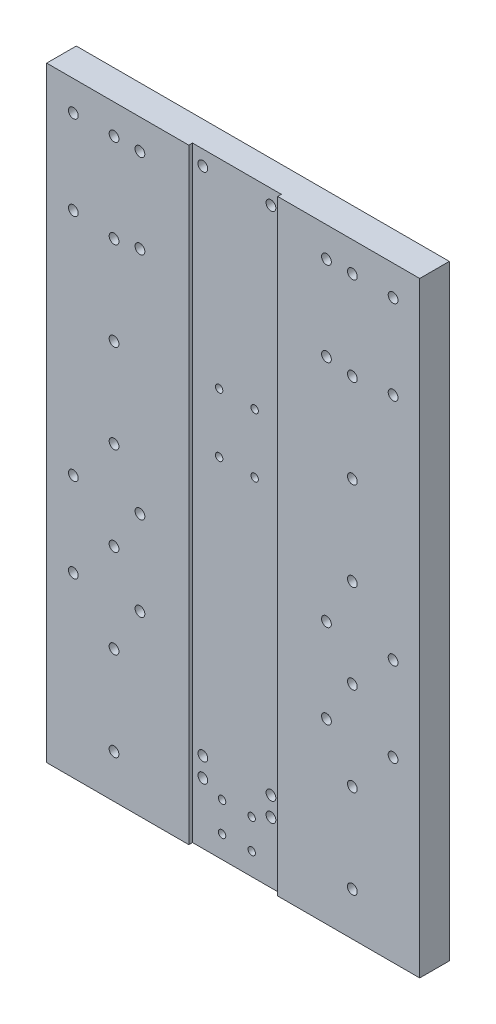
from build123d import *

# Parameters (mm, degrees)
SCHIZZO1_W                    = 252
SCHIZZO1_H                    = 500
ESTRUSIONE_ESTRUSIONE1_DEPTH  = 20
SCHIZZO3_W                    = 60
SCHIZZO3_H                    = 2.5
TAGLIO_ESTRUSIONE1_DEPTH      = 517.019379481
M6_CLEARANCE_HOLE2_AT_2_COUNT = 2
M6_CLEARANCE_HOLE2_AT_2_PITCH = 60
M6_CLEARANCE_HOLE2_AT_3_COUNT = 2
M6_CLEARANCE_HOLE2_AT_3_PITCH = 120
M6_CLEARANCE_HOLE2_AT_4_COUNT = 2
M6_CLEARANCE_HOLE2_AT_4_PITCH = 180
M6_CLEARANCE_HOLE2_AT_5_COUNT = 2
M6_CLEARANCE_HOLE2_AT_5_PITCH = 240
M6_CLEARANCE_HOLE2_AT_6_COUNT = 2
M6_CLEARANCE_HOLE2_AT_6_PITCH = 300
M6_CLEARANCE_HOLE2_AT_7_COUNT = 2
M6_CLEARANCE_HOLE2_AT_7_PITCH = 360
M6_CLEARANCE_HOLE4_AT_2_COUNT = 2
M6_CLEARANCE_HOLE4_AT_2_PITCH = 57
M6_CLEARANCE_HOLE4_AT_3_COUNT = 2
M6_CLEARANCE_HOLE4_AT_3_PITCH = 72.622310621
M6_CLEARANCE_HOLE4_AT_4_COUNT = 2
M6_CLEARANCE_HOLE4_AT_4_PITCH = 45
M6_CLEARANCE_HOLE4_AT_5_COUNT = 2
M6_CLEARANCE_HOLE4_AT_5_PITCH = 161.400123942
M6_CLEARANCE_HOLE4_AT_6_COUNT = 2
M6_CLEARANCE_HOLE4_AT_6_PITCH = 216.723325952
M6_CLEARANCE_HOLE4_AT_7_COUNT = 2
M6_CLEARANCE_HOLE4_AT_7_PITCH = 212.000000028
M6_CLEARANCE_HOLE4_AT_8_COUNT = 2
M6_CLEARANCE_HOLE4_AT_8_PITCH = 155.000000028
M6_CLEARANCE_HOLE3_D          = 6.6
M6_CLEARANCE_HOLE3_DEPTH      = 36.6
M6_CLEARANCE_HOLE3_TIP        = 1.982840043
SKETCH16_W                    = 252
SKETCH16_H                    = 158.679931771
CUT_EXTRUDE1_DEPTH            = 28
TAP_DRILL_FOR_M6_TAP1_D       = 5
TAP_DRILL_FOR_M6_TAP2_D       = 5
TAP_DRILL_FOR_M6_TAP2_DEPTH   = 30
TAP_DRILL_FOR_M6_TAP2_TIP     = 1.502151548
TAP_DRILL_FOR_M6_TAP3_D       = 5


with BuildPart() as part:
    # Schizzo1 → Estrusione-Estrusione1 (new body)
    with BuildSketch(Plane.XY):
        Rectangle(SCHIZZO1_W, SCHIZZO1_H)
    extrude(amount=ESTRUSIONE_ESTRUSIONE1_DEPTH)

    # Schizzo3 → Taglio-Estrusione1 (cut, through all)
    with BuildSketch(Plane(origin=(0, 250, 0), x_dir=(1, 0, 0), z_dir=(0, 1, 0))):
        with Locations((0, -18.75)):
            Rectangle(SCHIZZO3_W, SCHIZZO3_H)
    extrude(amount=-TAGLIO_ESTRUSIONE1_DEPTH, mode=Mode.SUBTRACT)

    # Sketch8 → M6 Clearance Hole2 (revolve, cut)
    with BuildSketch(Plane(origin=(80.500605801, -130, 20), x_dir=(0, -1, 0), z_dir=(1, 0, 0))):
        Polygon((0, 0), (0, 38.582840043), (3.3, 36.6), (3.3, 0), align=None)
    m6_clearance_hole2 = revolve(axis=Axis((80.500605801, -130, 26.35), (0, 0, -1)), mode=Mode.SUBTRACT)

    # M6 Clearance Hole2 at 2: M6 Clearance Hole2 ×2
    with Locations(*[(0, i * M6_CLEARANCE_HOLE2_AT_2_PITCH, 0) for i in range(1, M6_CLEARANCE_HOLE2_AT_2_COUNT)]):
        add(m6_clearance_hole2, mode=Mode.SUBTRACT)

    # M6 Clearance Hole2 at 3: M6 Clearance Hole2 ×2
    with Locations(*[(0, i * M6_CLEARANCE_HOLE2_AT_3_PITCH, 0) for i in range(1, M6_CLEARANCE_HOLE2_AT_3_COUNT)]):
        add(m6_clearance_hole2, mode=Mode.SUBTRACT)

    # M6 Clearance Hole2 at 4: M6 Clearance Hole2 ×2
    with Locations(*[(0, i * M6_CLEARANCE_HOLE2_AT_4_PITCH, 0) for i in range(1, M6_CLEARANCE_HOLE2_AT_4_COUNT)]):
        add(m6_clearance_hole2, mode=Mode.SUBTRACT)

    # M6 Clearance Hole2 at 5: M6 Clearance Hole2 ×2
    with Locations(*[(0, i * M6_CLEARANCE_HOLE2_AT_5_PITCH, 0) for i in range(1, M6_CLEARANCE_HOLE2_AT_5_COUNT)]):
        add(m6_clearance_hole2, mode=Mode.SUBTRACT)

    # M6 Clearance Hole2 at 6: M6 Clearance Hole2 ×2
    with Locations(*[(0, i * M6_CLEARANCE_HOLE2_AT_6_PITCH, 0) for i in range(1, M6_CLEARANCE_HOLE2_AT_6_COUNT)]):
        add(m6_clearance_hole2, mode=Mode.SUBTRACT)

    # M6 Clearance Hole2 at 7: M6 Clearance Hole2 ×2
    with Locations(*[(0, i * M6_CLEARANCE_HOLE2_AT_7_PITCH, 0) for i in range(1, M6_CLEARANCE_HOLE2_AT_7_COUNT)]):
        add(m6_clearance_hole2, mode=Mode.SUBTRACT)

    # Sketch15 → M6 Clearance Hole4 (revolve, cut)
    with BuildSketch(Plane(origin=(108, 172.808299679, 20), x_dir=(0, -1, 0), z_dir=(1, 0, 0))):
        Polygon((0, 0), (0, 38.582840043), (3.3, 36.6), (3.3, 0), align=None)
    m6_clearance_hole4 = revolve(axis=Axis((108, 172.808299679, 26.35), (0, 0, -1)), mode=Mode.SUBTRACT)

    # M6 Clearance Hole4 at 2: M6 Clearance Hole4 ×2
    with Locations(*[(0, i * M6_CLEARANCE_HOLE4_AT_2_PITCH, 0) for i in range(1, M6_CLEARANCE_HOLE4_AT_2_COUNT)]):
        add(m6_clearance_hole4, mode=Mode.SUBTRACT)

    # M6 Clearance Hole4 at 3: M6 Clearance Hole4 ×2
    with Locations(*[Vector(-0.6196442885790133, 0.7848827655334322, 0) * (i * M6_CLEARANCE_HOLE4_AT_3_PITCH) for i in range(1, M6_CLEARANCE_HOLE4_AT_3_COUNT)]):
        add(m6_clearance_hole4, mode=Mode.SUBTRACT)

    # M6 Clearance Hole4 at 4: M6 Clearance Hole4 ×2
    with Locations(*[(-i * M6_CLEARANCE_HOLE4_AT_4_PITCH, 0, 0) for i in range(1, M6_CLEARANCE_HOLE4_AT_4_COUNT)]):
        add(m6_clearance_hole4, mode=Mode.SUBTRACT)

    # M6 Clearance Hole4 at 5: M6 Clearance Hole4 ×2
    with Locations(*[Vector(-0.2788101948173676, -0.9603462267671496, 0) * (i * M6_CLEARANCE_HOLE4_AT_5_PITCH) for i in range(1, M6_CLEARANCE_HOLE4_AT_5_COUNT)]):
        add(m6_clearance_hole4, mode=Mode.SUBTRACT)

    # M6 Clearance Hole4 at 6: M6 Clearance Hole4 ×2
    with Locations(*[Vector(-0.20763800943997496, -0.9782057334915826, 0) * (i * M6_CLEARANCE_HOLE4_AT_6_PITCH) for i in range(1, M6_CLEARANCE_HOLE4_AT_6_COUNT)]):
        add(m6_clearance_hole4, mode=Mode.SUBTRACT)

    # M6 Clearance Hole4 at 7: M6 Clearance Hole4 ×2
    with Locations(*[(0, -i * M6_CLEARANCE_HOLE4_AT_7_PITCH, 0) for i in range(1, M6_CLEARANCE_HOLE4_AT_7_COUNT)]):
        add(m6_clearance_hole4, mode=Mode.SUBTRACT)

    # M6 Clearance Hole4 at 8: M6 Clearance Hole4 ×2
    with Locations(*[(0, -i * M6_CLEARANCE_HOLE4_AT_8_PITCH, 0) for i in range(1, M6_CLEARANCE_HOLE4_AT_8_COUNT)]):
        add(m6_clearance_hole4, mode=Mode.SUBTRACT)

    # M6 Clearance Hole3
    with Locations(Plane.XY.offset(17.5)):
        with Locations((23, -118), (23, -105), (-23, -118), (-23, -105), (23, 240), (-23, 240)):
            Hole(M6_CLEARANCE_HOLE3_D / 2, depth=M6_CLEARANCE_HOLE3_DEPTH)
            with Locations((0, 0, -(M6_CLEARANCE_HOLE3_DEPTH + M6_CLEARANCE_HOLE3_TIP / 2))):  # 118° drill point
                Cone(0, M6_CLEARANCE_HOLE3_D / 2, M6_CLEARANCE_HOLE3_TIP, mode=Mode.SUBTRACT)

    # Mirror1: M6 Clearance Hole2 across plane
    add(m6_clearance_hole2.mirror(Plane.ZY), mode=Mode.SUBTRACT)

    # Mirror1 copy 1 sketch → Mirror1 copy 1 (revolve, cut)
    with BuildSketch(Plane(origin=(-80.500605801, -70, 20), x_dir=(0, -1, 0), z_dir=(-1, 0, 0))):
        Polygon((0, 0), (0, -38.582840043), (3.3, -36.6), (3.3, 0), align=None)
    revolve(axis=Axis((-80.500605801, -70, 26.35), (0, 0, 1)), mode=Mode.SUBTRACT)

    # Mirror1 copy 2 sketch → Mirror1 copy 2 (revolve, cut)
    with BuildSketch(Plane(origin=(-80.500605801, -10, 20), x_dir=(0, -1, 0), z_dir=(-1, 0, 0))):
        Polygon((0, 0), (0, -38.582840043), (3.3, -36.6), (3.3, 0), align=None)
    revolve(axis=Axis((-80.500605801, -10, 26.35), (0, 0, 1)), mode=Mode.SUBTRACT)

    # Mirror1 copy 3 sketch → Mirror1 copy 3 (revolve, cut)
    with BuildSketch(Plane(origin=(-80.500605801, 50, 20), x_dir=(0, -1, 0), z_dir=(-1, 0, 0))):
        Polygon((0, 0), (0, -38.582840043), (3.3, -36.6), (3.3, 0), align=None)
    revolve(axis=Axis((-80.500605801, 50, 26.35), (0, 0, 1)), mode=Mode.SUBTRACT)

    # Mirror1 copy 4 sketch → Mirror1 copy 4 (revolve, cut)
    with BuildSketch(Plane(origin=(-80.500605801, 110, 20), x_dir=(0, -1, 0), z_dir=(-1, 0, 0))):
        Polygon((0, 0), (0, -38.582840043), (3.3, -36.6), (3.3, 0), align=None)
    revolve(axis=Axis((-80.500605801, 110, 26.35), (0, 0, 1)), mode=Mode.SUBTRACT)

    # Mirror1 copy 5 sketch → Mirror1 copy 5 (revolve, cut)
    with BuildSketch(Plane(origin=(-80.500605801, 170, 20), x_dir=(0, -1, 0), z_dir=(-1, 0, 0))):
        Polygon((0, 0), (0, -38.582840043), (3.3, -36.6), (3.3, 0), align=None)
    revolve(axis=Axis((-80.500605801, 170, 26.35), (0, 0, 1)), mode=Mode.SUBTRACT)

    # Mirror1 copy 6 sketch → Mirror1 copy 6 (revolve, cut)
    with BuildSketch(Plane(origin=(-80.500605801, 230, 20), x_dir=(0, -1, 0), z_dir=(-1, 0, 0))):
        Polygon((0, 0), (0, -38.582840043), (3.3, -36.6), (3.3, 0), align=None)
    revolve(axis=Axis((-80.500605801, 230, 26.35), (0, 0, 1)), mode=Mode.SUBTRACT)

    # Mirror2: M6 Clearance Hole4 across plane
    add(m6_clearance_hole4.mirror(Plane.ZY), mode=Mode.SUBTRACT)

    # Mirror2 copy 1 sketch → Mirror2 copy 1 (revolve, cut)
    with BuildSketch(Plane(origin=(-108, 229.808299679, 20), x_dir=(0, -1, 0), z_dir=(-1, 0, 0))):
        Polygon((0, 0), (0, -38.582840043), (3.3, -36.6), (3.3, 0), align=None)
    revolve(axis=Axis((-108, 229.808299679, 26.35), (0, 0, 1)), mode=Mode.SUBTRACT)

    # Mirror2 copy 2 sketch → Mirror2 copy 2 (revolve, cut)
    with BuildSketch(Plane(origin=(-63, 229.808299679, 20), x_dir=(0, -1, 0), z_dir=(-1, 0, 0))):
        Polygon((0, 0), (0, -38.582840043), (3.3, -36.6), (3.3, 0), align=None)
    revolve(axis=Axis((-63, 229.808299679, 26.35), (0, 0, 1)), mode=Mode.SUBTRACT)

    # Mirror2 copy 3 sketch → Mirror2 copy 3 (revolve, cut)
    with BuildSketch(Plane(origin=(-63, 172.808299679, 20), x_dir=(0, -1, 0), z_dir=(-1, 0, 0))):
        Polygon((0, 0), (0, -38.582840043), (3.3, -36.6), (3.3, 0), align=None)
    revolve(axis=Axis((-63, 172.808299679, 26.35), (0, 0, 1)), mode=Mode.SUBTRACT)

    # Mirror2 copy 4 sketch → Mirror2 copy 4 (revolve, cut)
    with BuildSketch(Plane(origin=(-63, 17.808299651, 20), x_dir=(0, -1, 0), z_dir=(-1, 0, 0))):
        Polygon((0, 0), (0, -38.582840043), (3.3, -36.6), (3.3, 0), align=None)
    revolve(axis=Axis((-63, 17.808299651, 26.35), (0, 0, 1)), mode=Mode.SUBTRACT)

    # Mirror2 copy 5 sketch → Mirror2 copy 5 (revolve, cut)
    with BuildSketch(Plane(origin=(-63, -39.191700349, 20), x_dir=(0, -1, 0), z_dir=(-1, 0, 0))):
        Polygon((0, 0), (0, -38.582840043), (3.3, -36.6), (3.3, 0), align=None)
    revolve(axis=Axis((-63, -39.191700349, 26.35), (0, 0, 1)), mode=Mode.SUBTRACT)

    # Mirror2 copy 6 sketch → Mirror2 copy 6 (revolve, cut)
    with BuildSketch(Plane(origin=(-108, -39.191700349, 20), x_dir=(0, -1, 0), z_dir=(-1, 0, 0))):
        Polygon((0, 0), (0, -38.582840043), (3.3, -36.6), (3.3, 0), align=None)
    revolve(axis=Axis((-108, -39.191700349, 26.35), (0, 0, 1)), mode=Mode.SUBTRACT)

    # Mirror2 copy 7 sketch → Mirror2 copy 7 (revolve, cut)
    with BuildSketch(Plane(origin=(-108, 17.808299651, 20), x_dir=(0, -1, 0), z_dir=(-1, 0, 0))):
        Polygon((0, 0), (0, -38.582840043), (3.3, -36.6), (3.3, 0), align=None)
    revolve(axis=Axis((-108, 17.808299651, 26.35), (0, 0, 1)), mode=Mode.SUBTRACT)

    # Sketch16 → Cut-Extrude1 (cut)
    with BuildSketch(Plane(origin=(0, 0, 0), x_dir=(-1, 0, 0), z_dir=(0, 0, -1))):
        with Locations((0, -238.589965886)):
            Rectangle(SKETCH16_W, SKETCH16_H)
    extrude(amount=-CUT_EXTRUDE1_DEPTH, mode=Mode.SUBTRACT)

    # Tap Drill for M6 Tap1 (through all)
    with Locations(Plane.XY.offset(17.5)):
        with Locations((-12, 75.308299651), (12, 75.308299651), (12, 115.308299651), (-12, 115.308299651)):
            Hole(TAP_DRILL_FOR_M6_TAP1_D / 2)

    # Tap Drill for M6 Tap2
    with Locations(Plane(origin=(0, -159.25, 0), x_dir=(-1, 0, 0), z_dir=(0, -1, 0))):
        with Locations((20, -10), (-20, -10)):
            Hole(TAP_DRILL_FOR_M6_TAP2_D / 2, depth=TAP_DRILL_FOR_M6_TAP2_DEPTH)
            with Locations((0, 0, -(TAP_DRILL_FOR_M6_TAP2_DEPTH + TAP_DRILL_FOR_M6_TAP2_TIP / 2))):  # 118° drill point
                Cone(0, TAP_DRILL_FOR_M6_TAP2_D / 2, TAP_DRILL_FOR_M6_TAP2_TIP, mode=Mode.SUBTRACT)

    # Tap Drill for M6 Tap3 (through all)
    with Locations(Plane(origin=(0, 0, 0), x_dir=(-1, 0, 0), z_dir=(0, 0, -1))):
        with Locations((-10, -144.25), (-10, -124.25), (10, -124.25), (10, -144.25)):
            Hole(TAP_DRILL_FOR_M6_TAP3_D / 2)


solid = part.part
